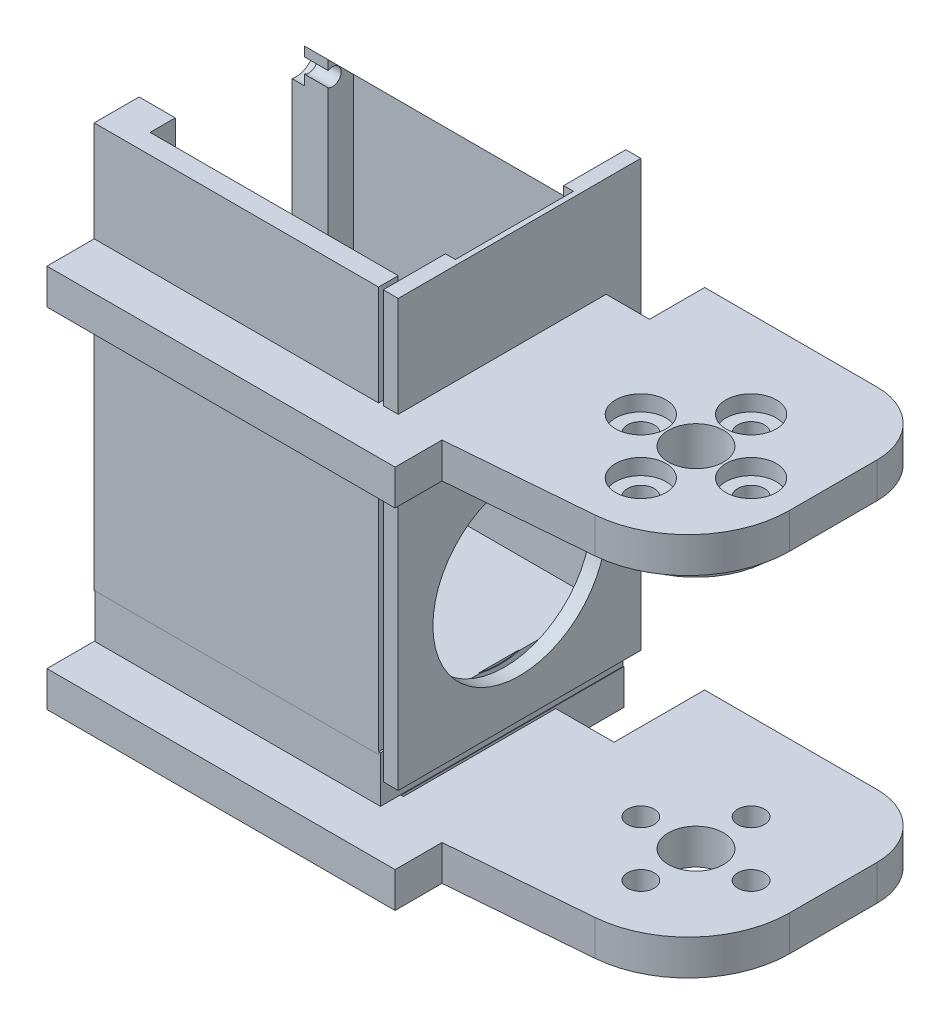
from build123d import *

# Parameters (mm, degrees)
BOSS_1_DEPTH    = 4.5
S_CYL2_R        = 9.5
BOSS_2_DEPTH    = 3.2
BOSS_3_DEPTH    = 4.5
S_PRISM4_W      = 7.5
S_PRISM4_H      = 21.95
BOSS_4_DEPTH    = 4.5
S_PRISM5_W      = 44.2
S_PRISM5_H      = 8.55
BOSS_5_DEPTH    = 4.5
S_PRISM6_W      = 36.4
S_PRISM6_H      = 30.9
BOSS_6_DEPTH    = 4.5
S_PRISM7_W      = 7.5
S_PRISM7_H      = 26.45
BOSS_7_DEPTH    = 4.5
S_PRISM8_W      = 44.2
S_PRISM8_H      = 8.55
BOSS_8_DEPTH    = 4.5
S_BOX9_W        = 36.1
S_BOX9_H        = 2.5
BOSS_9_DEPTH    = 30.8
S_BOX10_W       = 36.1
S_BOX10_H       = 51.4
BOSS_10_DEPTH   = 2.5
S_BOX11_W       = 36.1
S_BOX11_H       = 51.4
BOSS_11_DEPTH   = 2.5
S_BOX12_W       = 4.6
S_BOX12_H       = 51.4
BOSS_12_DEPTH   = 30.8
S_BOX13_W       = 1.9
S_BOX13_H       = 54.1
BOSS_13_DEPTH   = 30.8
S_BOX14_W       = 36.26
S_BOX14_H       = 6
BOSS_14_DEPTH   = 30.76
S_HOLE15_R      = 3.5
HOLE_15_DEPTH   = 4.7
S_HOLE16_R      = 1.7
HOLE_16_DEPTH   = 4.7
S_HOLE17_R      = 1.7
HOLE_17_DEPTH   = 4.7
S_HOLE18_R      = 1.7
HOLE_18_DEPTH   = 4.7
S_HOLE19_R      = 1.7
HOLE_19_DEPTH   = 4.7
S_HOLE20_R      = 3.2
HOLE_20_DEPTH   = 1.6
S_HOLE21_R      = 3.2
HOLE_21_DEPTH   = 1.6
S_HOLE22_R      = 3.2
HOLE_22_DEPTH   = 1.6
S_HOLE23_R      = 3.2
HOLE_23_DEPTH   = 1.6
S_HOLE24_R      = 3.5
HOLE_24_DEPTH   = 7.9
S_HOLE25_R      = 1.7
HOLE_25_DEPTH   = 7.9
S_HOLE26_R      = 1.7
HOLE_26_DEPTH   = 7.9
S_HOLE27_R      = 1.7
HOLE_27_DEPTH   = 7.9
S_HOLE28_R      = 1.7
HOLE_28_DEPTH   = 7.9
S_HOLE29_R      = 3.2
HOLE_29_DEPTH   = 2.1
S_HOLE30_R      = 3.2
HOLE_30_DEPTH   = 2.1
S_HOLE31_R      = 3.2
HOLE_31_DEPTH   = 2.1
S_HOLE32_R      = 3.2
HOLE_32_DEPTH   = 2.1
S_CUT33_W       = 6.8
S_CUT33_H       = 1
POCKET_33_DEPTH = 10
S_HOLE34_R      = 10.5
HOLE_34_DEPTH   = 4.8
S_CUT35_W       = 4.75
S_CUT35_H       = 19.5
POCKET_35_DEPTH = 19.4
S_CUT36_W       = 4.75
S_CUT36_H       = 8.3
POCKET_36_DEPTH = 19.4
S_CUT37_W       = 4.75
S_CUT37_H       = 11
POCKET_37_DEPTH = 7
S_CUT38_W       = 2.9
S_CUT38_H       = 20
POCKET_38_DEPTH = 15.9
S_HOLE39_R      = 1.1
HOLE_39_DEPTH   = 4.8
S_HOLE40_R      = 2.3
HOLE_40_DEPTH   = 1.7
S_HOLE41_R      = 1.1
HOLE_41_DEPTH   = 4.8
S_HOLE42_R      = 2.3
HOLE_42_DEPTH   = 1.7
S_HOLE43_R      = 1.1
HOLE_43_DEPTH   = 4.8
S_HOLE44_R      = 2.3
HOLE_44_DEPTH   = 1.7
S_HOLE45_R      = 11
HOLE_45_DEPTH   = 2.7
S_CUT46_W       = 1.85
S_CUT46_H       = 30.6
POCKET_46_DEPTH = 15
CUT_47_DEPTH    = 36.3


with BuildPart() as part:
    # S_prism1 → Boss_1 (new body)
    with BuildSketch(Plane(origin=(0, -23.3, 0), x_dir=(1, 0, 0), z_dir=(0, 1, 0))):
        with BuildLine():
            Line((13, 10), (13, -1.1138))
            ThreePointArc((13, -1.1138), (9.586829994, -9.855067448), (1.1535, -13.9707))
            Line((1.1535, -13.9707), (-16.9, -15.45))
            Line((-16.9, -15.45), (-16.9, 18))
            Line((-16.9, 18), (5, 18))
            ThreePointArc((5, 18), (10.6569, 15.6569), (13, 10))
        make_face()
    extrude(amount=BOSS_1_DEPTH)

    # S_prism4 → Boss_4 (add)
    with BuildSketch(Plane(origin=(0, -23.3, 0), x_dir=(1, 0, 0), z_dir=(0, 1, 0))):
        with Locations((-20.55, -4.475)):
            Rectangle(S_PRISM4_W, S_PRISM4_H)
    extrude(amount=BOSS_4_DEPTH)

    # S_prism5 → Boss_5 (add)
    with BuildSketch(Plane(origin=(0, -23.3, 0), x_dir=(1, 0, 0), z_dir=(0, 1, 0))):
        with Locations((-38.9, -17.125)):
            Rectangle(S_PRISM5_W, S_PRISM5_H)
    extrude(amount=BOSS_5_DEPTH)

    # S_prism6 → Boss_6 (add)
    with BuildSketch(Plane(origin=(0, -23.3, 0), x_dir=(1, 0, 0), z_dir=(0, 1, 0))):
        with Locations((-42.8, 0)):
            Rectangle(S_PRISM6_W, S_PRISM6_H)
    extrude(amount=BOSS_6_DEPTH)



with BuildPart() as body_2:
    # S_cyl2 → Boss_2 (new body)
    with BuildSketch(Plane(origin=(0, 17.75, 0), x_dir=(1, 0, 0), z_dir=(0, 1, 0))):
        Circle(S_CYL2_R)
    extrude(amount=BOSS_2_DEPTH)

    # S_prism3 → Boss_3 (add)
    with BuildSketch(Plane(origin=(0, 20.95, 0), x_dir=(1, 0, 0), z_dir=(0, 1, 0))):
        with BuildLine():
            Line((13, 10), (13, -1.1138))
            ThreePointArc((13, -1.1138), (9.586829994, -9.855067448), (1.1535, -13.9707))
            Line((1.1535, -13.9707), (-16.9, -15.45))
            Line((-16.9, -15.45), (-16.9, 18))
            Line((-16.9, 18), (5, 18))
            ThreePointArc((5, 18), (10.6569, 15.6569), (13, 10))
        make_face()
    extrude(amount=BOSS_3_DEPTH)

    # S_prism7 → Boss_7 (add)
    with BuildSketch(Plane(origin=(0, 20.95, 0), x_dir=(1, 0, 0), z_dir=(0, 1, 0))):
        with Locations((-20.55, -2.225)):
            Rectangle(S_PRISM7_W, S_PRISM7_H)
    extrude(amount=BOSS_7_DEPTH)

    # S_prism8 → Boss_8 (add)
    with BuildSketch(Plane(origin=(0, 20.95, 0), x_dir=(1, 0, 0), z_dir=(0, 1, 0))):
        with Locations((-38.9, -17.125)):
            Rectangle(S_PRISM8_W, S_PRISM8_H)
    extrude(amount=BOSS_8_DEPTH)



with BuildPart() as body_3:
    # S_box9 → Boss_9 (new body)
    with BuildSketch(Plane.XY.offset(-15.4)):
        with Locations((-42.95, -11.95)):
            Rectangle(S_BOX9_W, S_BOX9_H)
    extrude(amount=BOSS_9_DEPTH)

    # S_box10 → Boss_10 (add)
    with BuildSketch(Plane.XY.offset(-15.4)):
        with Locations((-42.95, 12.5)):
            Rectangle(S_BOX10_W, S_BOX10_H)
    extrude(amount=BOSS_10_DEPTH)


with BuildPart() as body_2_1:
    add(body_2.part)

    add(body_3.part)  # Boss_11 merges body 3
    # S_box11 → Boss_11 (add)
    with BuildSketch(Plane.XY.offset(12.9)):
        with Locations((-42.95, 12.5)):
            Rectangle(S_BOX11_W, S_BOX11_H)
    extrude(amount=BOSS_11_DEPTH)

    # S_box12 → Boss_12 (add)
    with BuildSketch(Plane.XY.offset(-15.4)):
        with Locations((-58.7, 12.5)):
            Rectangle(S_BOX12_W, S_BOX12_H)
    extrude(amount=BOSS_12_DEPTH)

    # S_box13 → Boss_13 (add)
    with BuildSketch(Plane.XY.offset(-15.4)):
        with Locations((-23.35, 11.15)):
            Rectangle(S_BOX13_W, S_BOX13_H)
    extrude(amount=BOSS_13_DEPTH)


with BuildPart() as part_1:
    add(part.part)

    add(body_2_1.part)  # Boss_14 merges body 2
    # S_box14 → Boss_14 (add)
    with BuildSketch(Plane.XY.offset(-15.38)):
        with Locations((-42.8, -15.9)):
            Rectangle(S_BOX14_W, S_BOX14_H)
    extrude(amount=BOSS_14_DEPTH)

    # S_hole15 → Hole_15 (cut)
    with BuildSketch(Plane(origin=(0, -23.4, 0), x_dir=(1, 0, 0), z_dir=(0, 1, 0))):
        Circle(S_HOLE15_R)
    extrude(amount=HOLE_15_DEPTH, mode=Mode.SUBTRACT)

    # S_hole16 → Hole_16 (cut)
    with BuildSketch(Plane(origin=(0, -23.4, 0), x_dir=(1, 0, 0), z_dir=(0, 1, 0))):
        with Locations((7, 0)):
            Circle(S_HOLE16_R)
    extrude(amount=HOLE_16_DEPTH, mode=Mode.SUBTRACT)

    # S_hole17 → Hole_17 (cut)
    with BuildSketch(Plane(origin=(0, -23.4, 0), x_dir=(1, 0, 0), z_dir=(0, 1, 0))):
        with Locations((0, -7)):
            Circle(S_HOLE17_R)
    extrude(amount=HOLE_17_DEPTH, mode=Mode.SUBTRACT)

    # S_hole18 → Hole_18 (cut)
    with BuildSketch(Plane(origin=(0, -23.4, 0), x_dir=(1, 0, 0), z_dir=(0, 1, 0))):
        with Locations((-7, 0)):
            Circle(S_HOLE18_R)
    extrude(amount=HOLE_18_DEPTH, mode=Mode.SUBTRACT)

    # S_hole19 → Hole_19 (cut)
    with BuildSketch(Plane(origin=(0, -23.4, 0), x_dir=(1, 0, 0), z_dir=(0, 1, 0))):
        with Locations((0, 7)):
            Circle(S_HOLE19_R)
    extrude(amount=HOLE_19_DEPTH, mode=Mode.SUBTRACT)

    # S_hole20 → Hole_20 (cut)
    with BuildSketch(Plane(origin=(0, -23.4, 0), x_dir=(1, 0, 0), z_dir=(0, 1, 0))):
        with Locations((7, 0)):
            Circle(S_HOLE20_R)
    extrude(amount=HOLE_20_DEPTH, mode=Mode.SUBTRACT)

    # S_hole21 → Hole_21 (cut)
    with BuildSketch(Plane(origin=(0, -23.4, 0), x_dir=(1, 0, 0), z_dir=(0, 1, 0))):
        with Locations((0, -7)):
            Circle(S_HOLE21_R)
    extrude(amount=HOLE_21_DEPTH, mode=Mode.SUBTRACT)

    # S_hole22 → Hole_22 (cut)
    with BuildSketch(Plane(origin=(0, -23.4, 0), x_dir=(1, 0, 0), z_dir=(0, 1, 0))):
        with Locations((-7, 0)):
            Circle(S_HOLE22_R)
    extrude(amount=HOLE_22_DEPTH, mode=Mode.SUBTRACT)

    # S_hole23 → Hole_23 (cut)
    with BuildSketch(Plane(origin=(0, -23.4, 0), x_dir=(1, 0, 0), z_dir=(0, 1, 0))):
        with Locations((0, 7)):
            Circle(S_HOLE23_R)
    extrude(amount=HOLE_23_DEPTH, mode=Mode.SUBTRACT)

    # S_hole24 → Hole_24 (cut)
    with BuildSketch(Plane(origin=(0, 17.65, 0), x_dir=(1, 0, 0), z_dir=(0, 1, 0))):
        Circle(S_HOLE24_R)
    extrude(amount=HOLE_24_DEPTH, mode=Mode.SUBTRACT)

    # S_hole25 → Hole_25 (cut)
    with BuildSketch(Plane(origin=(0, 17.65, 0), x_dir=(1, 0, 0), z_dir=(0, 1, 0))):
        with Locations((7, 0)):
            Circle(S_HOLE25_R)
    extrude(amount=HOLE_25_DEPTH, mode=Mode.SUBTRACT)

    # S_hole26 → Hole_26 (cut)
    with BuildSketch(Plane(origin=(0, 17.65, 0), x_dir=(1, 0, 0), z_dir=(0, 1, 0))):
        with Locations((0, -7)):
            Circle(S_HOLE26_R)
    extrude(amount=HOLE_26_DEPTH, mode=Mode.SUBTRACT)

    # S_hole27 → Hole_27 (cut)
    with BuildSketch(Plane(origin=(0, 17.65, 0), x_dir=(1, 0, 0), z_dir=(0, 1, 0))):
        with Locations((-7, 0)):
            Circle(S_HOLE27_R)
    extrude(amount=HOLE_27_DEPTH, mode=Mode.SUBTRACT)

    # S_hole28 → Hole_28 (cut)
    with BuildSketch(Plane(origin=(0, 17.65, 0), x_dir=(1, 0, 0), z_dir=(0, 1, 0))):
        with Locations((0, 7)):
            Circle(S_HOLE28_R)
    extrude(amount=HOLE_28_DEPTH, mode=Mode.SUBTRACT)

    # S_hole29 → Hole_29 (cut)
    with BuildSketch(Plane(origin=(0, 23.45, 0), x_dir=(1, 0, 0), z_dir=(0, 1, 0))):
        with Locations((7, 0)):
            Circle(S_HOLE29_R)
    extrude(amount=HOLE_29_DEPTH, mode=Mode.SUBTRACT)

    # S_hole30 → Hole_30 (cut)
    with BuildSketch(Plane(origin=(0, 23.45, 0), x_dir=(1, 0, 0), z_dir=(0, 1, 0))):
        with Locations((0, -7)):
            Circle(S_HOLE30_R)
    extrude(amount=HOLE_30_DEPTH, mode=Mode.SUBTRACT)

    # S_hole31 → Hole_31 (cut)
    with BuildSketch(Plane(origin=(0, 23.45, 0), x_dir=(1, 0, 0), z_dir=(0, 1, 0))):
        with Locations((-7, 0)):
            Circle(S_HOLE31_R)
    extrude(amount=HOLE_31_DEPTH, mode=Mode.SUBTRACT)

    # S_hole32 → Hole_32 (cut)
    with BuildSketch(Plane(origin=(0, 23.45, 0), x_dir=(1, 0, 0), z_dir=(0, 1, 0))):
        with Locations((0, 7)):
            Circle(S_HOLE32_R)
    extrude(amount=HOLE_32_DEPTH, mode=Mode.SUBTRACT)

    # S_cut33 → Pocket_33 (cut)
    with BuildSketch(Plane.XY):
        with Locations((0, 18.15)):
            Rectangle(S_CUT33_W, S_CUT33_H)
    extrude(amount=POCKET_33_DEPTH, mode=Mode.SUBTRACT)

    # S_hole34 → Hole_34 (cut)
    with BuildSketch(Plane(origin=(-61.1, 0, 0), x_dir=(0, 0, -1), z_dir=(1, 0, 0))):
        Circle(S_HOLE34_R)
    extrude(amount=HOLE_34_DEPTH, mode=Mode.SUBTRACT)

    # S_cut35 → Pocket_35 (cut)
    with BuildSketch(Plane.XY.offset(-9.7)):
        with Locations((-58.725, 20.65)):
            Rectangle(S_CUT35_W, S_CUT35_H)
    extrude(amount=POCKET_35_DEPTH, mode=Mode.SUBTRACT)

    # S_cut36 → Pocket_36 (cut)
    with BuildSketch(Plane.XY.offset(-9.7)):
        with Locations((-58.725, 34.55)):
            Rectangle(S_CUT36_W, S_CUT36_H)
    extrude(amount=POCKET_36_DEPTH, mode=Mode.SUBTRACT)

    # S_cut37 → Pocket_37 (cut)
    with BuildSketch(Plane.XY.offset(-3.5)):
        with Locations((-58.725, 5.5)):
            Rectangle(S_CUT37_W, S_CUT37_H)
    extrude(amount=POCKET_37_DEPTH, mode=Mode.SUBTRACT)

    # S_cut38 → Pocket_38 (cut)
    with BuildSketch(Plane.XY.offset(-15.9)):
        with Locations((-59.75, 0)):
            Rectangle(S_CUT38_W, S_CUT38_H)
    extrude(amount=POCKET_38_DEPTH, mode=Mode.SUBTRACT)

    # S_hole39 → Hole_39 (cut)
    with BuildSketch(Plane(origin=(-61.1, 0, 0), x_dir=(0, 0, -1), z_dir=(1, 0, 0))):
        with Locations((-10.25, 8.3)):
            Circle(S_HOLE39_R)
    extrude(amount=HOLE_39_DEPTH, mode=Mode.SUBTRACT)

    # S_hole40 → Hole_40 (cut)
    with BuildSketch(Plane(origin=(-61.1, 0, 0), x_dir=(0, 0, -1), z_dir=(1, 0, 0))):
        with Locations((-10.25, 8.3)):
            Circle(S_HOLE40_R)
    extrude(amount=HOLE_40_DEPTH, mode=Mode.SUBTRACT)

    # S_hole41 → Hole_41 (cut)
    with BuildSketch(Plane(origin=(-61.1, 0, 0), x_dir=(0, 0, -1), z_dir=(1, 0, 0))):
        with Locations((10.25, 32.75)):
            Circle(S_HOLE41_R)
    extrude(amount=HOLE_41_DEPTH, mode=Mode.SUBTRACT)

    # S_hole42 → Hole_42 (cut)
    with BuildSketch(Plane(origin=(-61.1, 0, 0), x_dir=(0, 0, -1), z_dir=(1, 0, 0))):
        with Locations((10.25, 32.75)):
            Circle(S_HOLE42_R)
    extrude(amount=HOLE_42_DEPTH, mode=Mode.SUBTRACT)

    # S_hole43 → Hole_43 (cut)
    with BuildSketch(Plane(origin=(-61.1, 0, 0), x_dir=(0, 0, -1), z_dir=(1, 0, 0))):
        with Locations((-10.25, 32.75)):
            Circle(S_HOLE43_R)
    extrude(amount=HOLE_43_DEPTH, mode=Mode.SUBTRACT)

    # S_hole44 → Hole_44 (cut)
    with BuildSketch(Plane(origin=(-61.1, 0, 0), x_dir=(0, 0, -1), z_dir=(1, 0, 0))):
        with Locations((-10.25, 32.75)):
            Circle(S_HOLE44_R)
    extrude(amount=HOLE_44_DEPTH, mode=Mode.SUBTRACT)

    # S_hole45 → Hole_45 (cut)
    with BuildSketch(Plane(origin=(-25, 0, 0), x_dir=(0, 0, -1), z_dir=(1, 0, 0))):
        Circle(S_HOLE45_R)
    extrude(amount=HOLE_45_DEPTH, mode=Mode.SUBTRACT)

    # S_cut46 → Pocket_46 (cut)
    with BuildSketch(Plane.XY.offset(-7.5)):
        with Locations((-23.975, 23.4)):
            Rectangle(S_CUT46_W, S_CUT46_H)
    extrude(amount=POCKET_46_DEPTH, mode=Mode.SUBTRACT)

    # S_pcut47 → Cut_47 (cut)
    with BuildSketch(Plane(origin=(-61.1, 0, 0), x_dir=(0, 0, -1), z_dir=(1, 0, 0))):
        Polygon((16, 38.8), (16, 28.6), (5.8, 38.8), align=None)
    extrude(amount=CUT_47_DEPTH, mode=Mode.SUBTRACT)


solid = part_1.part
